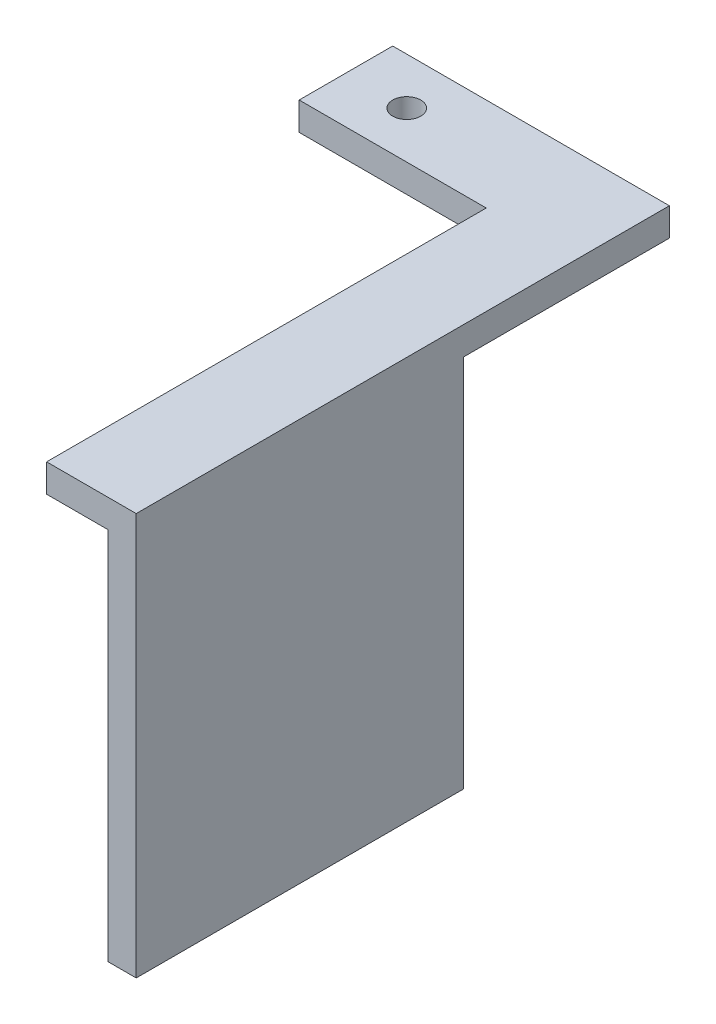
from build123d import *

# Parameters (mm, degrees)
BOSS_EXTRUDE1_DEPTH = 3
SKETCH2_R           = 1.5
CUT_EXTRUDE1_DEPTH  = 3
SKETCH3_W           = 3
SKETCH3_H           = 35
BOSS_EXTRUDE2_DEPTH = 40


with BuildPart() as part:
    # Sketch1 → Boss-Extrude1 (new body)
    with BuildSketch(Plane(origin=(0, 0, 0), x_dir=(1, 0, 0), z_dir=(0, 1, 0))):
        Polygon((10, -5), (10, -52), (19.57850172, -52), (19.57850172, 5), (10, 5), (-10, 5), (-10, -5), align=None)
    extrude(amount=BOSS_EXTRUDE1_DEPTH)

    # Sketch2 → Cut-Extrude1 (cut)
    with BuildSketch(Plane(origin=(0, 3, 0), x_dir=(1, 0, 0), z_dir=(0, 1, 0))):
        with Locations((-3.5, 0)):
            Circle(SKETCH2_R)
    extrude(amount=-CUT_EXTRUDE1_DEPTH, mode=Mode.SUBTRACT)

    # Sketch3 → Boss-Extrude2 (add)
    with BuildSketch(Plane.XZ):
        with Locations((18.07850172, 34.5)):
            Rectangle(SKETCH3_W, SKETCH3_H)
    extrude(amount=BOSS_EXTRUDE2_DEPTH)


solid = part.part
